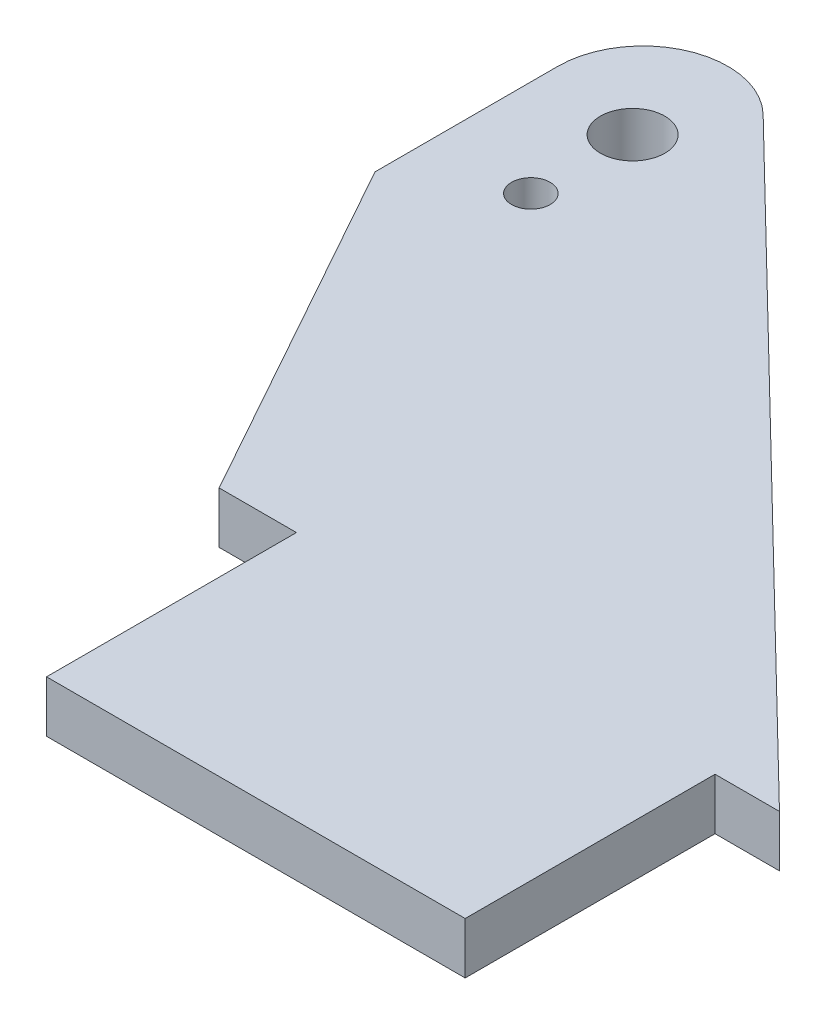
from build123d import *

# Parameters (mm, degrees)
BOSS_EXTRUDE1_DEPTH = 1.016
SKETCH2_R           = 0.635
SKETCH2_R_2         = 0.381
CUT_EXTRUDE1_DEPTH  = 20.63947316


with BuildPart() as part:
    # Sketch1 → Boss-Extrude1 (new body)
    with BuildSketch(Plane(origin=(0, 0, 0), x_dir=(1, 0, 0), z_dir=(0, 1, 0))):
        with BuildLine():
            Line((0, 0), (8.255, 0))
            Line((8.255, 0), (8.255, 4.9276))
            Line((8.255, 4.9276), (9.525, 4.9276))
            Line((9.525, 4.9276), (-2.539137852, 16.669908865))
            ThreePointArc((-2.539137852, 16.669908865), (-4.360383855, 17.013020284), (-5.3848, 15.4686))
            Line((-5.3848, 15.4686), (-5.3848, 11.8618))
            Line((-5.3848, 11.8618), (-1.524, 4.9276))
            Line((-1.524, 4.9276), (0, 4.9276))
            Line((0, 4.9276), (0, 0))
        make_face()
    extrude(amount=BOSS_EXTRUDE1_DEPTH)

    # Sketch2 → Cut-Extrude1 (cut, through all)
    with BuildSketch(Plane(origin=(0, 1.016, 0), x_dir=(1, 0, 0), z_dir=(0, 1, 0))):
        with Locations((-3.4798, 15.0368)):
            Circle(SKETCH2_R)
        with Locations((-3.4798, 13.0302)):
            Circle(SKETCH2_R_2)
    extrude(amount=-CUT_EXTRUDE1_DEPTH, mode=Mode.SUBTRACT)


solid = part.part
